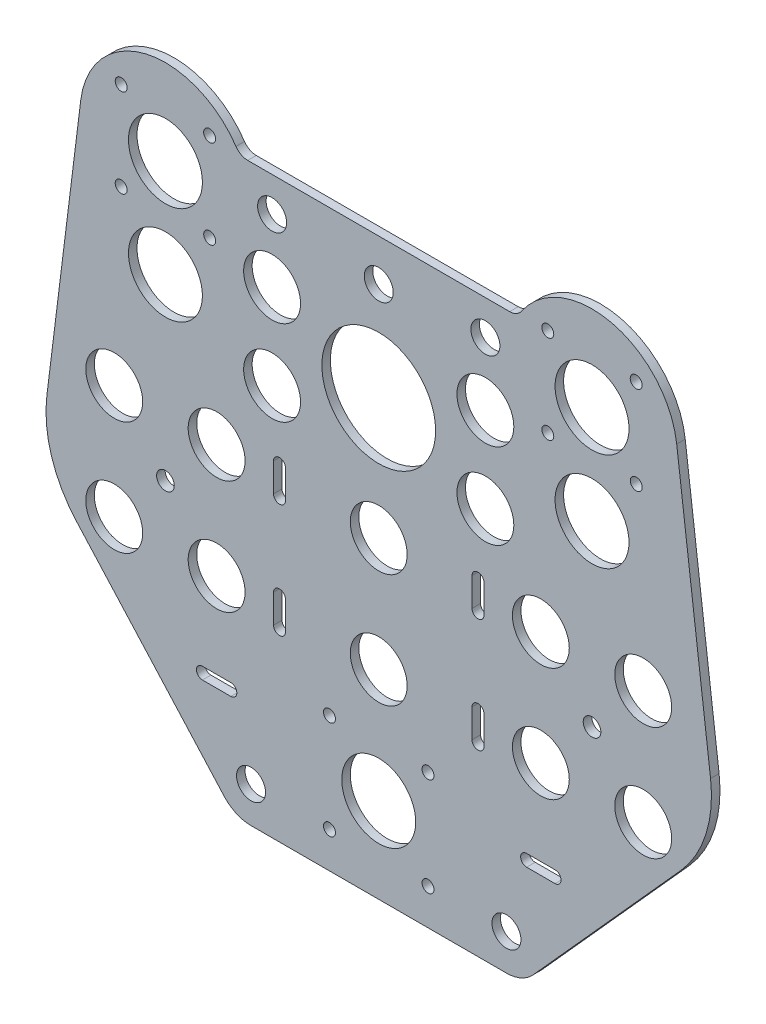
from build123d import *

# Parameters (mm, degrees)
MODEL_R             = 2.1
MODEL_R_2           = 13
MODEL_R_3           = 3.1
MODEL_R_4           = 10
MODEL_R_5           = 5.1
MODEL_R_6           = 20
BOSS_EXTRUDE1_DEPTH = 3


with BuildPart() as part:
    # Model → Boss-Extrude1 (new body)
    with BuildSketch(Plane.XY):
        with BuildLine():
            Line((-44.9, -112.113099849), (0, -112.113099849))
            Line((0, -112.113099849), (44.9, -112.113099849))
            ThreePointArc((44.9, -112.113099849), (50.059264201, -111.015645267), (54.325169295, -107.913312696))
            Line((54.325169295, -107.913312696), (106.229152519, -50.197615742))
            ThreePointArc((106.229152519, -50.197615742), (115.069026633, -34.701709967), (116.679519982, -16.934527261))
            Line((116.679519982, -16.934527261), (104.771085702, 78.90999671))
            ThreePointArc((104.771085702, 78.90999671), (82.034748438, 104.374560561), (50.189310486, 92.0760596))
            ThreePointArc((50.189310486, 92.0760596), (48.393618278, 90.467952157), (46.054195567, 89.886900151))
            Line((46.054195567, 89.886900151), (0, 89.886900151))
            Line((0, 89.886900151), (-46.054195567, 89.886900151))
            ThreePointArc((-46.054195567, 89.886900151), (-48.393618278, 90.467952157), (-50.189310486, 92.0760596))
            ThreePointArc((-50.189310486, 92.0760596), (-82.034748438, 104.374560561), (-104.771085702, 78.90999671))
            Line((-104.771085702, 78.90999671), (-116.679519982, -16.934527261))
            ThreePointArc((-116.679519982, -16.934527261), (-115.069026633, -34.701709967), (-106.229152519, -50.197615742))
            Line((-106.229152519, -50.197615742), (-54.325169295, -107.913312696))
            ThreePointArc((-54.325169295, -107.913312696), (-50.059264201, -111.015645267), (-44.9, -112.113099849))
        make_face()
        with Locations((17.324116139, -99.437215988)):
            Circle(MODEL_R, mode=Mode.SUBTRACT)
        with Locations((-17.324116139, -64.78898371)):
            Circle(MODEL_R, mode=Mode.SUBTRACT)
        with Locations((0, -82.113099849)):
            Circle(MODEL_R_2, mode=Mode.SUBTRACT)
        with Locations((-75, 75.21101629)):
            Circle(MODEL_R_2, mode=Mode.SUBTRACT)
        with Locations((17.324116139, -64.78898371)):
            Circle(MODEL_R, mode=Mode.SUBTRACT)
        with Locations((-17.324116139, -99.437215988)):
            Circle(MODEL_R, mode=Mode.SUBTRACT)
        with Locations((-75, -22.113099849)):
            Circle(MODEL_R_3, mode=Mode.SUBTRACT)
        with Locations((-57, -2.113099849)):
            Circle(MODEL_R_4, mode=Mode.SUBTRACT)
        with Locations((-57, -42.113099849)):
            Circle(MODEL_R_4, mode=Mode.SUBTRACT)
        with Locations((-93, -2.113099849)):
            Circle(MODEL_R_4, mode=Mode.SUBTRACT)
        with Locations((-93, -42.113099849)):
            Circle(MODEL_R_4, mode=Mode.SUBTRACT)
        with Locations((-44.9, -99.437215988)):
            Circle(MODEL_R_5, mode=Mode.SUBTRACT)
        with Locations((75, -22.113099849)):
            Circle(MODEL_R_3, mode=Mode.SUBTRACT)
        with Locations((57, -2.113099849)):
            Circle(MODEL_R_4, mode=Mode.SUBTRACT)
        with Locations((57, -42.113099849)):
            Circle(MODEL_R_4, mode=Mode.SUBTRACT)
        with Locations((93, -2.113099849)):
            Circle(MODEL_R_4, mode=Mode.SUBTRACT)
        with Locations((93, -42.113099849)):
            Circle(MODEL_R_4, mode=Mode.SUBTRACT)
        with Locations((44.9, -99.437215988)):
            Circle(MODEL_R_5, mode=Mode.SUBTRACT)
        with Locations((0, 75.21101629)):
            Circle(MODEL_R_5, mode=Mode.SUBTRACT)
        with Locations((0, -2.113099849)):
            Circle(MODEL_R_4, mode=Mode.SUBTRACT)
        with Locations((0, -42.113099849)):
            Circle(MODEL_R_4, mode=Mode.SUBTRACT)
        with Locations((0, 40.562784012)):
            Circle(MODEL_R_6, mode=Mode.SUBTRACT)
        with Locations((-37.5, 55.562784012)):
            Circle(MODEL_R_4, mode=Mode.SUBTRACT)
        with Locations((-37.5, 25.562784012)):
            Circle(MODEL_R_4, mode=Mode.SUBTRACT)
        with Locations((37.5, 55.562784012)):
            Circle(MODEL_R_4, mode=Mode.SUBTRACT)
        with Locations((37.5, 25.562784012)):
            Circle(MODEL_R_4, mode=Mode.SUBTRACT)
        with Locations((75, 75.21101629)):
            Circle(MODEL_R_2, mode=Mode.SUBTRACT)
        with Locations((-75, 40.688174024)):
            Circle(MODEL_R_2, mode=Mode.SUBTRACT)
        with Locations((75, 40.562784012)):
            Circle(MODEL_R_2, mode=Mode.SUBTRACT)
        with Locations((-37.5, 77.724842082)):
            Circle(MODEL_R_5, mode=Mode.SUBTRACT)
        with Locations((37.5, 77.724842082)):
            Circle(MODEL_R_5, mode=Mode.SUBTRACT)
        with Locations((90.532377607, 90.743393898)):
            Circle(MODEL_R, mode=Mode.SUBTRACT)
        with Locations((59.443650814, 90.767365476)):
            Circle(MODEL_R, mode=Mode.SUBTRACT)
        with Locations((59.443650814, 59.654667104)):
            Circle(MODEL_R, mode=Mode.SUBTRACT)
        with Locations((90.556349186, 59.654667104)):
            Circle(MODEL_R, mode=Mode.SUBTRACT)
        with Locations((-59.467622393, 90.743393898)):
            Circle(MODEL_R, mode=Mode.SUBTRACT)
        with Locations((-90.556349186, 90.767365476)):
            Circle(MODEL_R, mode=Mode.SUBTRACT)
        with Locations((-90.556349186, 59.654667104)):
            Circle(MODEL_R, mode=Mode.SUBTRACT)
        with Locations((-59.443650814, 59.654667104)):
            Circle(MODEL_R, mode=Mode.SUBTRACT)
        with BuildLine():
            Line((-37, 2.886900151), (-37, -7.113099849))
            ThreePointArc((-37, -7.113099849), (-34.9, -9.213099849), (-32.8, -7.113099849))
            Line((-32.8, -7.113099849), (-32.8, 2.886900151))
            ThreePointArc((-32.8, 2.886900151), (-34.9, 4.986900151), (-37, 2.886900151))
        make_face(mode=Mode.SUBTRACT)
        with BuildLine():
            Line((-37, -37.113099849), (-37, -47.113099849))
            ThreePointArc((-37, -47.113099849), (-34.9, -49.213099849), (-32.8, -47.113099849))
            Line((-32.8, -47.113099849), (-32.8, -37.113099849))
            ThreePointArc((-32.8, -37.113099849), (-34.9, -35.013099849), (-37, -37.113099849))
        make_face(mode=Mode.SUBTRACT)
        with BuildLine():
            Line((37, 2.886900151), (37, -7.113099849))
            ThreePointArc((37, -7.113099849), (34.9, -9.213099849), (32.8, -7.113099849))
            Line((32.8, -7.113099849), (32.8, 2.886900151))
            ThreePointArc((32.8, 2.886900151), (34.9, 4.986900151), (37, 2.886900151))
        make_face(mode=Mode.SUBTRACT)
        with BuildLine():
            Line((37, -37.113099849), (37, -47.113099849))
            ThreePointArc((37, -47.113099849), (34.9, -49.213099849), (32.8, -47.113099849))
            Line((32.8, -47.113099849), (32.8, -37.113099849))
            ThreePointArc((32.8, -37.113099849), (34.9, -35.013099849), (37, -37.113099849))
        make_face(mode=Mode.SUBTRACT)
        with BuildLine():
            Line((-62, -72.113099849), (-52, -72.113099849))
            ThreePointArc((-52, -72.113099849), (-49.9, -74.213099849), (-52, -76.313099849))
            Line((-52, -76.313099849), (-62, -76.313099849))
            ThreePointArc((-62, -76.313099849), (-64.1, -74.213099849), (-62, -72.113099849))
        make_face(mode=Mode.SUBTRACT)
        with BuildLine():
            Line((62, -72.113099849), (52, -72.113099849))
            ThreePointArc((52, -72.113099849), (49.9, -74.213099849), (52, -76.313099849))
            Line((52, -76.313099849), (62, -76.313099849))
            ThreePointArc((62, -76.313099849), (64.1, -74.213099849), (62, -72.113099849))
        make_face(mode=Mode.SUBTRACT)
    extrude(amount=BOSS_EXTRUDE1_DEPTH)


solid = part.part
